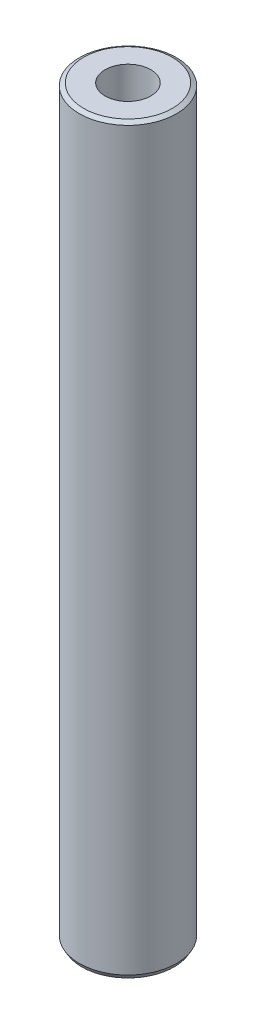
from build123d import *
from OCP.BRepFilletAPI import BRepFilletAPI_MakeChamfer

# Parameters (mm, degrees)
SKETCH1_R           = 7.5
BOSS_EXTRUDE1_DEPTH = 114.585905107
SKETCH2_R           = 3.524893606
CUT_EXTRUDE1_DEPTH  = 116.075756131
CHAMFER1_SIZE       = 0.381062991
CHAMFER1_SIZE2      = 0.660020462


with BuildPart() as part:
    # Sketch1 → Boss-Extrude1 (new body)
    with BuildSketch(Plane(origin=(0, 0, 0), x_dir=(1, 0, 0), z_dir=(0, 1, 0))):
        Circle(SKETCH1_R)
    extrude(amount=BOSS_EXTRUDE1_DEPTH)

    # Sketch2 → Cut-Extrude1 (cut, through all)
    with BuildSketch(Plane(origin=(0, 0, 0), x_dir=(1, 0, 0), z_dir=(0, 1, 0))):
        Circle(SKETCH2_R)
    extrude(amount=CUT_EXTRUDE1_DEPTH, mode=Mode.SUBTRACT)

    # Chamfer1: one chamfer whose edges measure the first distance from different faces: ONE call of the kernel's chamfer builder (chamfer() names one face for all edges)
    chamfer1_edges_1 = [part.edges().sort_by_distance(p)[0] for p in [
        (-7.5, 114.585905107, 0),
    ]]
    chamfer1_side_1 = [part.faces().sort_by_distance(p)[0] for p in [
        (-7.5, 57.292952553, 0),
    ]]
    chamfer1_edges_2 = [part.edges().sort_by_distance(p)[0] for p in [
        (-7.5, 0, 0),
    ]]
    chamfer1_side_2 = [part.faces().sort_by_distance(p)[0] for p in [
        (-7.287867966, 0, 0),
    ]]
    chamfer1 = BRepFilletAPI_MakeChamfer(part.part.solid().wrapped)
    for e in chamfer1_edges_1:
        chamfer1.Add(CHAMFER1_SIZE, CHAMFER1_SIZE2, e.wrapped, chamfer1_side_1[0].wrapped)  # the first distance lies on this face
    for e in chamfer1_edges_2:
        chamfer1.Add(CHAMFER1_SIZE, CHAMFER1_SIZE2, e.wrapped, chamfer1_side_2[0].wrapped)  # the first distance lies on this face
    add(Compound.cast(chamfer1.Shape()), mode=Mode.REPLACE)


solid = part.part
